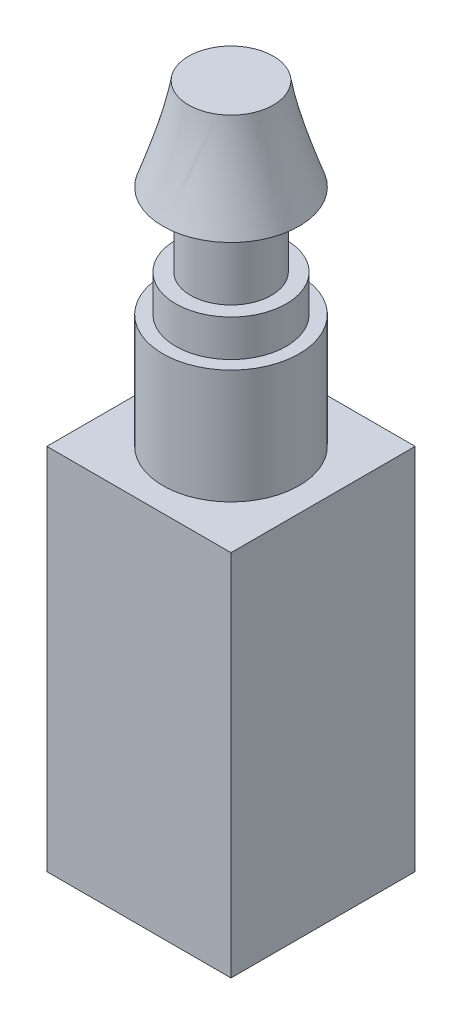
from build123d import *

# Parameters (mm, degrees)
SKETCH1_R           = 1.85
BOSS_EXTRUDE1_DEPTH = 3.1
SKETCH2_R           = 1.5
BOSS_EXTRUDE2_DEPTH = 1
SKETCH3_R           = 1.1
BOSS_EXTRUDE3_DEPTH = 2
SKETCH6_W           = 5
SKETCH6_H           = 5
BOSS_EXTRUDE4_DEPTH = 10


with BuildPart() as part:
    # Sketch1 → Boss-Extrude1 (new body)
    with BuildSketch(Plane(origin=(0, 0, 0), x_dir=(1, 0, 0), z_dir=(0, 1, 0))):
        with Locations(Location((0, 0, 0), (0, 0, 90))):
            Circle(SKETCH1_R)
    extrude(amount=BOSS_EXTRUDE1_DEPTH)

    # Sketch2 → Boss-Extrude2 (add)
    with BuildSketch(Plane(origin=(0, 3.1, 0), x_dir=(1, 0, 0), z_dir=(0, 1, 0))):
        with Locations(Location((0, 0, 0), (0, 0, 270))):
            Circle(SKETCH2_R)
    extrude(amount=BOSS_EXTRUDE2_DEPTH)

    # Sketch3 → Boss-Extrude3 (add)
    with BuildSketch(Plane(origin=(0, 4.1, 0), x_dir=(1, 0, 0), z_dir=(0, 1, 0))):
        with Locations(Location((0, 0, 0), (0, 0, 270))):
            Circle(SKETCH3_R)
    extrude(amount=BOSS_EXTRUDE3_DEPTH)

    # Loft1: read off the stored shape, not the designer's step
    # Loft1: loft between two sections, ruled curve by curve
    loft1_from = [
        Edge.make_bspline([(0, 6.1, 1.85), (3.7, 6.1, 1.85), (3.7, 6.1, -1.85), (0, 6.1, -1.85), (-3.7, 6.1, -1.85), (-3.7, 6.1, 1.85), (0, 6.1, 1.85)], [0, 0, 0, 0, 0.5, 0.5, 0.5, 1, 1, 1, 1], 3, [1, 0.333333333, 0.333333333, 1, 0.333333333, 0.333333333, 1]),
    ]
    loft1_to = [
        Edge.make_bspline([(0.620465421, 8.6, 0.968257539), (2.556980499, 8.6, -0.272673303), (1.316049657, 8.6, -2.209188381), (-0.620465421, 8.6, -0.968257539), (-2.556980499, 8.6, 0.272673303), (-1.316049657, 8.6, 2.209188381), (0.620465421, 8.6, 0.968257539)], [0, 0, 0, 0, 0.5, 0.5, 0.5, 1, 1, 1, 1], 3, [1, 0.333333333, 0.333333333, 1, 0.333333333, 0.333333333, 1]),
    ]
    loft1 = Solid(Shell([*[Face.make_surface_from_curves(loft1_from[k], loft1_to[k]) for k in range(1)], Face(Wire(loft1_from)), Face(Wire(loft1_to))]))
    add(loft1)

    # Sketch6 → Boss-Extrude4 (add)
    with BuildSketch(Plane.XZ):
        Rectangle(SKETCH6_W, SKETCH6_H)
    extrude(amount=BOSS_EXTRUDE4_DEPTH)


solid = part.part
